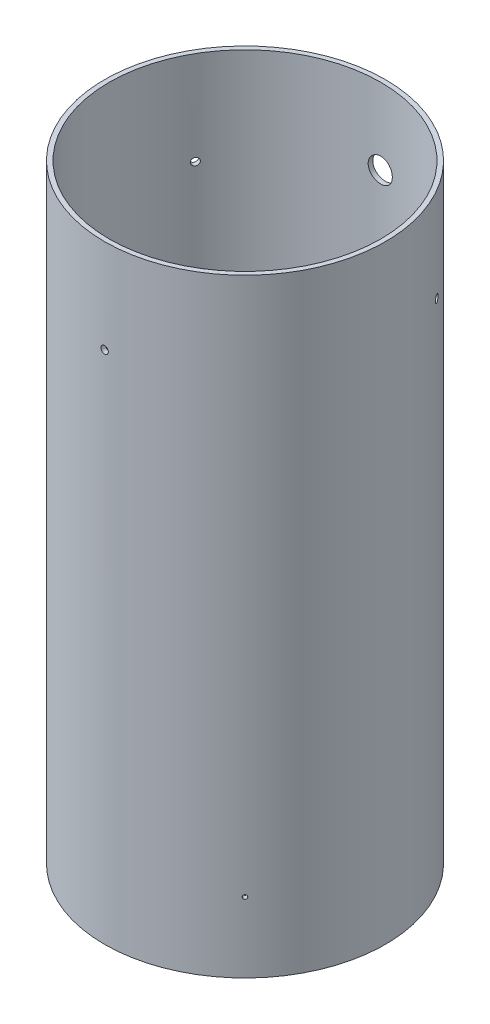
from build123d import *

# Parameters (mm, degrees)
SKETCH1_R           = 76.1746
SKETCH1_R_2         = 73.66
BOSS_EXTRUDE1_DEPTH = 330.2
SKETCH23_R          = 1.0922
SHEAR_SCRREWS_DEPTH = 348.328633238
CIRPATTERN1_COUNT   = 4
CIRPATTERN2_COUNT   = 3


with BuildPart() as part:
    # Sketch1 → Boss-Extrude1 (new body)
    with BuildSketch(Plane(origin=(0, 0, 0), x_dir=(1, 0, 0), z_dir=(0, 1, 0))):
        Circle(SKETCH1_R)
        Circle(SKETCH1_R_2, mode=Mode.SUBTRACT)
    extrude(amount=BOSS_EXTRUDE1_DEPTH)

    # Sketch17 → 1/2 Clearance Hole5 (revolve, cut)
    with BuildSketch(Plane(origin=(0, 288.925, 0), x_dir=(0, -1, 0), z_dir=(1, 0, 0))):
        Polygon((0, 0), (0, 80.134507437), (6.54812, 76.2), (6.54812, 0), align=None)
    revolve(axis=Axis((0, 288.925, 6.35), (0, 0, -1)), mode=Mode.SUBTRACT)

    # Sketch21 → 1/2 Clearance Hole7 (revolve, cut)
    with BuildSketch(Plane(origin=(0, 41.275, 0), x_dir=(0, -1, 0), z_dir=(1, 0, 0))):
        Polygon((0, 0), (0, 80.134507437), (6.54812, 76.2), (6.54812, 0), align=None)
    revolve(axis=Axis((0, 41.275, 6.35), (0, 0, -1)), mode=Mode.SUBTRACT)

    # Sketch23 → Shear Scrrews (cut, through all)
    with BuildSketch(Plane(origin=(0, 0, 0), x_dir=(0.7071067811865477, 0, 0.7071067811865475), z_dir=(-0.7071067811865475, 0, 0.7071067811865477))):
        with Locations((0, 38.1)):
            Circle(SKETCH23_R)
    shear_scrrews = extrude(amount=-SHEAR_SCRREWS_DEPTH, mode=Mode.SUBTRACT)

    # CirPattern1: Shear Scrrews ×4 about axis
    cirpattern1_axis = Axis((0, 330.2, 0), (0, -1, 0))
    for i in range(1, CIRPATTERN1_COUNT):
        add(shear_scrrews.rotate(cirpattern1_axis, i * 360 / CIRPATTERN1_COUNT), mode=Mode.SUBTRACT)

    # Sketch25 → Ø4.0 (4) Diameter Hole1 (revolve, cut)
    with BuildSketch(Plane(origin=(0, 279.4, 0), x_dir=(0, 1, 0), z_dir=(1, 0, 0))):
        Polygon((0, 0), (0, 90.101721238), (2, 88.9), (2, 0), align=None)
    f_4_0_4_diameter_hole1 = revolve(axis=Axis((0, 279.4, -6.35), (0, 0, 1)), mode=Mode.SUBTRACT)

    # CirPattern2: Ø4.0 (4) Diameter Hole1 ×3 about axis
    cirpattern2_axis = Axis((0, 330.2, 0), (0, 1, 0))
    for i in range(1, CIRPATTERN2_COUNT):
        add(f_4_0_4_diameter_hole1.rotate(cirpattern2_axis, i * 360 / CIRPATTERN2_COUNT), mode=Mode.SUBTRACT)


solid = part.part
